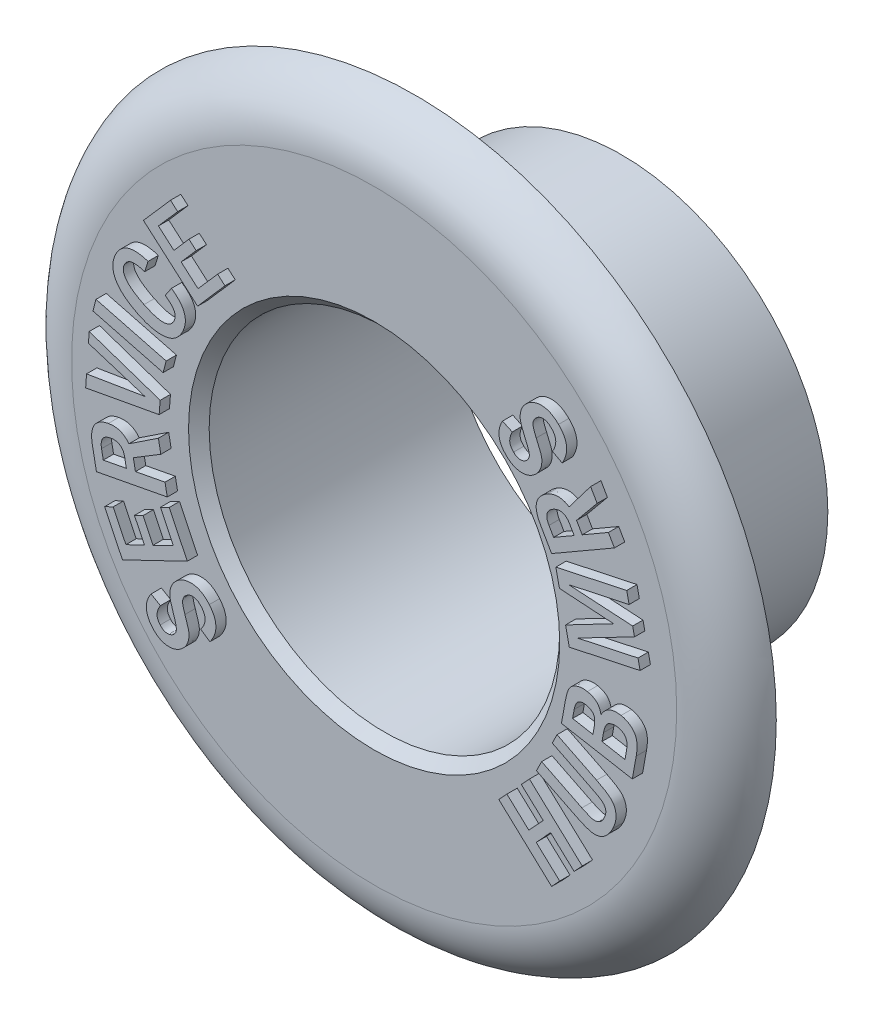
from build123d import *

# Parameters (mm, degrees)
ESQUISSE1_R        = 10
ESQUISSE1_R_2      = 8.5
BOSS_EXTRU_1_DEPTH = 10
ESQUISSE2_R        = 17.5
ESQUISSE2_R_2      = 8.5
BOSS_EXTRU_2_DEPTH = 2
CONG_1_R           = 3
CHANFREIN1_SIZE    = 0.5
BOSS_EXTRU_3_DEPTH = 0.5


with BuildPart() as part:
    # Esquisse1 → Boss.-Extru.1 (new body)
    with BuildSketch(Plane.XY):
        Circle(ESQUISSE1_R)
        Circle(ESQUISSE1_R_2, mode=Mode.SUBTRACT)
    extrude(amount=BOSS_EXTRU_1_DEPTH)

    # Esquisse2 → Boss.-Extru.2 (add)
    with BuildSketch(Plane.XY.offset(10)):
        Circle(ESQUISSE2_R)
        Circle(ESQUISSE2_R_2, mode=Mode.SUBTRACT)
    extrude(amount=BOSS_EXTRU_2_DEPTH)

    # Congé1
    # the kernel refuses this fillet: 3 mm, written as the material it takes off along each edge
    with BuildSketch(Plane(origin=(0, 0, 12), x_dir=(1, 0, 0), z_dir=(0, -1, 0))) as cong_1_piece_1:
        with BuildLine():
            CenterArc((14.671572875, -3), CONG_1_R, 19.471220634, 70.528779366)
            Line((14.671572875, 0), (14.671572875, 0.06))
            Line((14.671572875, 0.06), (17.5, 0.06))
            Line((17.5, 0.06), (17.56, 0))
            ThreePointArc((17.56, 0), (17.56, -1), (17.556568542, -1.98))
            Line((17.556568542, -1.98), (17.5, -2))
        make_face()
    revolve(axis=Axis((0, 0, 12), (0, 0, 1)), mode=Mode.SUBTRACT)

    # Chanfrein1
    chanfrein1_edges = [part.edges().sort_by_distance(p)[0] for p in [
        (-8.5, 0, 12),
    ]]
    chamfer(chanfrein1_edges, length=CHANFREIN1_SIZE)

    # Esquisse3 → Boss.-Extru.3 (add)
    # profile 1 of 13: a face of its own
    with BuildSketch(Plane.XY.offset(12)):
        Polygon((-10.68446492, 8.147242191), (-9.374243566, 9.650388892), (-9.026370302, 9.347328996), (-9.958336448, 8.278644101), (-9.208661969, 7.624672746), (-8.477976205, 8.462454864), (-8.127824295, 8.157116323), (-8.858510059, 7.319334205), (-8.037438011, 6.603079864), (-7.089521344, 7.689234378), (-6.734052594, 7.379338545), (-8.060224469, 5.858722226), align=None)
    # profile 2 of 13: a face of its own
    with BuildSketch(Plane.XY.offset(12)):
        with BuildLine():
            Line((-9.629167081, 5.527917033), (-9.327626283, 5.973772068))
            add(Edge.make_bspline(
                [(-9.327626283, 5.973772068), (-9.288523151, 5.946412466), (-9.212247057, 5.89304376), (-9.107112651, 5.807054021), (-9.011973374, 5.720329142), (-8.928285511, 5.631574205), (-8.855470707, 5.540730464), (-8.793890013, 5.44824142), (-8.742978381, 5.353996308), (-8.703537218, 5.257978965), (-8.673680199, 5.160228846), (-8.657805151, 5.060066664), (-8.65033756, 4.958597019), (-8.655158448, 4.855396274), (-8.671523419, 4.75090668), (-8.698381765, 4.644612685), (-8.736398456, 4.536602557), (-8.769261427, 4.465812838), (-8.786068123, 4.429609741)],
                knots=[0, 0, 0, 0, 1.25831485, 2.45451805, 3.579291553, 4.651643519, 5.668437617, 6.646312129, 7.578428866, 8.488641703, 9.380244482, 10.267259418, 11.157410686, 12.059775972, 12.985291658, 13.942449899, 14.947733, 16, 16, 16, 16], degree=3))
            add(Edge.make_bspline(
                [(-8.786068123, 4.429609741), (-8.81018458, 4.383990006), (-8.857164132, 4.295121447), (-8.941744596, 4.17424993), (-9.036572059, 4.070271564), (-9.140141608, 3.981492211), (-9.253338153, 3.90889875), (-9.375881609, 3.851979466), (-9.508024686, 3.81283806), (-9.647996102, 3.788642515), (-9.794917323, 3.780390366), (-9.9472984, 3.7844226), (-10.104714086, 3.80072544), (-10.266500887, 3.833417166), (-10.433894746, 3.875891862), (-10.605605251, 3.934902249), (-10.782820552, 4.005059515), (-10.900444854, 4.060799242), (-10.960655796, 4.089331964)],
                knots=[0, 0, 0, 0, 0.995387172, 1.939042868, 2.838471923, 3.705148016, 4.564615462, 5.426122934, 6.304269616, 7.216983654, 8.162005062, 9.139719801, 10.157035791, 11.212287137, 12.322937725, 13.488188407, 14.714223669, 16, 16, 16, 16], degree=3))
            add(Edge.make_bspline(
                [(-10.960655796, 4.089331964), (-11.024625405, 4.121729481), (-11.148771362, 4.184603414), (-11.322823813, 4.288936283), (-11.482513303, 4.394292836), (-11.624351326, 4.505474254), (-11.7511753, 4.619037692), (-11.861491547, 4.736510345), (-11.955839706, 4.857932349), (-12.033877365, 4.982722027), (-12.094992332, 5.110343035), (-12.138855826, 5.240145813), (-12.166254265, 5.371734131), (-12.174081114, 5.505409196), (-12.165597993, 5.64032507), (-12.140213385, 5.776841018), (-12.096589977, 5.914884746), (-12.055637119, 6.004551454), (-12.034657533, 6.050486477)],
                knots=[0, 0, 0, 0, 1.36088723, 2.641076774, 3.850211054, 4.990550643, 6.0591517, 7.079351571, 8.04558552, 8.973893925, 9.868283002, 10.725557099, 11.569234989, 12.412049838, 13.259661871, 14.12981556, 15.041930203, 16, 16, 16, 16], degree=3))
            add(Edge.make_bspline(
                [(-12.034657533, 6.050486477), (-12.01652265, 6.085263021), (-11.981137638, 6.153119455), (-11.918996908, 6.247158573), (-11.85151828, 6.331725909), (-11.778308094, 6.406645257), (-11.699608943, 6.471925409), (-11.614881406, 6.526813123), (-11.524337953, 6.571833383), (-11.428542262, 6.607954947), (-11.326671475, 6.632474705), (-11.219692835, 6.64879245), (-11.107049122, 6.654182251), (-10.988647643, 6.651516802), (-10.864875715, 6.636983963), (-10.735461796, 6.614242785), (-10.600506815, 6.581420565), (-10.509833527, 6.552834093), (-10.463151456, 6.538116686)],
                knots=[0, 0, 0, 0, 1.02887218, 2.007548468, 2.952992882, 3.864623913, 4.752053024, 5.631258426, 6.507948933, 7.401601169, 8.312214402, 9.252953045, 10.237881195, 11.268233043, 12.357988157, 13.505130795, 14.715546058, 16, 16, 16, 16], degree=3))
            Line((-10.463151456, 6.538116686), (-10.628733053, 6.020104533))
            add(Edge.make_bspline(
                [(-10.628733053, 6.020104533), (-10.659284304, 6.03073682), (-10.718742162, 6.051429033), (-10.806615965, 6.077366329), (-10.89059078, 6.097112446), (-10.97037151, 6.112045558), (-11.046299705, 6.12017085), (-11.117876374, 6.123762672), (-11.185223932, 6.120599536), (-11.248527079, 6.112348989), (-11.307993987, 6.098984017), (-11.363248167, 6.079315092), (-11.413439469, 6.05283468), (-11.460879665, 6.022610163), (-11.502895401, 5.985089734), (-11.541526442, 5.94273923), (-11.576123915, 5.894759269), (-11.594564513, 5.859089535), (-11.60399347, 5.840851061)],
                knots=[0, 0, 0, 0, 1.413799054, 2.751490137, 4.002320606, 5.183148462, 6.296449753, 7.337619889, 8.312456566, 9.238987682, 10.124841889, 10.971971393, 11.793562264, 12.600792888, 13.424244837, 14.246803994, 15.103564363, 16, 16, 16, 16], degree=3))
            add(Edge.make_bspline(
                [(-11.60399347, 5.840851061), (-11.615174608, 5.816079379), (-11.637111522, 5.767478402), (-11.655803847, 5.690905822), (-11.663107717, 5.614325479), (-11.657428003, 5.537974141), (-11.64041178, 5.461436327), (-11.611004664, 5.385097142), (-11.56960988, 5.308814069), (-11.515353809, 5.233214837), (-11.449787203, 5.157470957), (-11.372597091, 5.081285228), (-11.283002271, 5.005218028), (-11.181591009, 4.929215913), (-11.068422054, 4.852676526), (-10.942679842, 4.77732874), (-10.805745366, 4.700369443), (-10.708955482, 4.651999665), (-10.659114998, 4.62709238)],
                knots=[0, 0, 0, 0, 0.762739505, 1.496462176, 2.204065549, 2.917622913, 3.639510571, 4.400986876, 5.209955146, 6.073014985, 7.011856248, 8.023561265, 9.119133035, 10.313562916, 11.58498584, 12.958347195, 14.433746976, 16, 16, 16, 16], degree=3))
            add(Edge.make_bspline(
                [(-10.659114998, 4.62709238), (-10.612152376, 4.604789843), (-10.52113503, 4.561565728), (-10.386967021, 4.503360182), (-10.258935918, 4.455786848), (-10.138201985, 4.415335725), (-10.023635328, 4.385934168), (-9.915894253, 4.364839714), (-9.814793259, 4.353085173), (-9.720250628, 4.35084177), (-9.632254647, 4.356029984), (-9.550911717, 4.372301282), (-9.476025688, 4.396912023), (-9.40814468, 4.431844591), (-9.346433462, 4.475279497), (-9.29263992, 4.529257152), (-9.244493259, 4.59125456), (-9.219603038, 4.6380633), (-9.206858053, 4.662031616)],
                knots=[0, 0, 0, 0, 1.53911643, 2.98293173, 4.32778885, 5.58167492, 6.750622574, 7.826677445, 8.829887108, 9.75958998, 10.623645347, 11.433600667, 12.208678301, 12.949511569, 13.685780671, 14.433107302, 15.197675913, 16, 16, 16, 16], degree=3))
            add(Edge.make_bspline(
                [(-9.206858053, 4.662031616), (-9.197875835, 4.681879427), (-9.180438706, 4.720409868), (-9.16110149, 4.779360296), (-9.149506607, 4.837497929), (-9.145528884, 4.894712099), (-9.149521356, 4.950607241), (-9.160150064, 5.005307331), (-9.17846353, 5.058776824), (-9.214886129, 5.129861082), (-9.276884659, 5.218549592), (-9.372458475, 5.322651747), (-9.491234603, 5.427701806), (-9.581463575, 5.493257917), (-9.629167081, 5.527917033)],
                knots=[0, 0, 0, 0, 0.734552614, 1.425982771, 2.087600162, 2.729576946, 3.354511132, 3.972579313, 4.604593488, 5.253913844, 6.661062636, 8.239250348, 10.011714634, 12, 12, 12, 12], degree=3))
        make_face()
    # profile 3 of 13: a face of its own
    with BuildSketch(Plane.XY.offset(12)):
        Polygon((-13.133591563, 3.119179753), (-12.986998681, 3.682005274), (-9.584980452, 2.795612045), (-9.731573334, 2.232786524), align=None)
    # profile 4 of 13: a face of its own
    with BuildSketch(Plane.XY.offset(12)):
        Polygon((-13.487774917, -0.285368175), (-13.445240195, 0.32454936), (-10.607566584, 0.793190853), (-13.351815715, 1.655278526), (-13.316116931, 2.167973839), (-9.873842625, 0.999788075), (-9.925491931, 0.372400922), align=None)
    # profile 5 of 13: a face of its own
    with BuildSketch(Plane.XY.offset(12)):
        with BuildLine():
            Line((-12.965405852, -3.544240459), (-13.162128942, -2.5104948))
            add(Edge.make_bspline(
                [(-13.162128942, -2.5104948), (-13.17008957, -2.465013184), (-13.185462186, -2.377184512), (-13.197760614, -2.247949754), (-13.200024323, -2.12660272), (-13.194061619, -2.012602975), (-13.17631, -1.906555741), (-13.149844896, -1.807998756), (-13.114405164, -1.716492165), (-13.067588988, -1.633276534), (-13.011540857, -1.557876991), (-12.948086226, -1.488619313), (-12.875503261, -1.426717498), (-12.793638717, -1.373147109), (-12.704194849, -1.325678323), (-12.606213687, -1.285525798), (-12.499834641, -1.251767873), (-12.425028715, -1.236310979), (-12.38662981, -1.228376744)],
                knots=[0, 0, 0, 0, 1.290793418, 2.49262631, 3.625590054, 4.682399745, 5.679870009, 6.626179873, 7.532004329, 8.416325126, 9.287166724, 10.153941036, 11.037808278, 11.946946737, 12.8843961, 13.865220213, 14.904188337, 16, 16, 16, 16], degree=3))
            add(Edge.make_bspline(
                [(-12.38662981, -1.228376744), (-12.335364083, -1.22026901), (-12.236027982, -1.204558892), (-12.088933948, -1.202537929), (-11.950051897, -1.217857883), (-11.819456852, -1.252807835), (-11.697879044, -1.307937076), (-11.58437868, -1.380582285), (-11.479849702, -1.47305104), (-11.419542924, -1.545759331), (-11.388582935, -1.583085945)],
                knots=[0, 0, 0, 0, 1.10925397, 2.149368998, 3.136351053, 4.090288788, 5.028550404, 5.981149299, 6.963572659, 8, 8, 8, 8], degree=3))
            Line((-11.388582935, -1.583085945), (-9.960631547, -0.635169279))
            Line((-9.960631547, -0.635169279), (-9.842901512, -1.251922751))
            Line((-9.842901512, -1.251922751), (-11.174390227, -2.060842022))
            Line((-11.174390227, -2.060842022), (-11.073370262, -2.594045147))
            Line((-11.073370262, -2.594045147), (-9.639342484, -2.320607647))
            Line((-9.639342484, -2.320607647), (-9.530727033, -2.889509557))
            Line((-9.530727033, -2.889509557), (-12.965405852, -3.544240459))
        make_face()
        with BuildLine():
            Line((-12.633483109, -2.891028654), (-11.513908456, -2.677595494))
            Line((-11.513908456, -2.677595494), (-11.596699255, -2.24237414))
            add(Edge.make_bspline(
                [(-11.596699255, -2.24237414), (-11.60168705, -2.219003108), (-11.611373057, -2.173617924), (-11.630882925, -2.108868857), (-11.655294572, -2.050216025), (-11.683432073, -1.997047911), (-11.716129362, -1.949943556), (-11.752724351, -1.90818378), (-11.794288414, -1.873190408), (-11.854086854, -1.833608608), (-11.937611993, -1.797561564), (-12.046234501, -1.77311482), (-12.164176856, -1.768518469), (-12.243955168, -1.780926114), (-12.285609845, -1.787404522)],
                knots=[0, 0, 0, 0, 0.914520806, 1.775946179, 2.584041781, 3.342806041, 4.074024624, 4.774208137, 5.461667363, 6.147074263, 7.513839802, 8.915044919, 10.389251365, 12, 12, 12, 12], degree=3))
            add(Edge.make_bspline(
                [(-12.285609845, -1.787404522), (-12.30720935, -1.791885773), (-12.349284331, -1.800615074), (-12.409298565, -1.818800401), (-12.464099077, -1.840876791), (-12.514077707, -1.866013391), (-12.559154408, -1.894722795), (-12.598946, -1.927856423), (-12.634135785, -1.963922386), (-12.663088889, -2.004581586), (-12.68882559, -2.047515902), (-12.707199177, -2.095255634), (-12.722152535, -2.14570938), (-12.73078397, -2.200070364), (-12.735515075, -2.257975203), (-12.734525427, -2.319487234), (-12.728254543, -2.384434041), (-12.720853602, -2.428502949), (-12.717033456, -2.451250008)],
                knots=[0, 0, 0, 0, 1.165356172, 2.270067758, 3.308625834, 4.283981557, 5.222959475, 6.125779299, 7.015315027, 7.877045866, 8.758291616, 9.652744439, 10.571680299, 11.535124667, 12.555159645, 13.639012621, 14.78132856, 16, 16, 16, 16], degree=3))
            Line((-12.717033456, -2.451250008), (-12.633483109, -2.891028654))
        make_face(mode=Mode.SUBTRACT)
    # profile 6 of 13: a face of its own
    with BuildSketch(Plane.XY.offset(12)):
        Polygon((-11.702584446, -6.614832221), (-12.569229411, -4.813942464), (-12.152237224, -4.613421631), (-11.5362433, -5.894020589), (-10.638456842, -5.46183743), (-11.121529758, -4.457714166), (-10.702258925, -4.255674235), (-10.219186008, -5.259797499), (-9.236330106, -4.786598714), (-9.862198161, -3.485491943), (-9.43609139, -3.280413818), (-8.559572293, -5.101811388), align=None)
    # profile 7 of 13: a face of its own
    with BuildSketch(Plane.XY.offset(12)):
        with BuildLine():
            Line((-10.314825514, -7.352409652), (-9.864413188, -7.618251666))
            add(Edge.make_bspline(
                [(-9.864413188, -7.618251666), (-9.887816073, -7.657535695), (-9.932180437, -7.732005612), (-9.98211838, -7.845457071), (-10.015106839, -7.952158308), (-10.030326203, -8.054042303), (-10.024278486, -8.153295863), (-9.995873138, -8.250434551), (-9.945800643, -8.346320416), (-9.899882194, -8.404842111), (-9.875806417, -8.435525972)],
                knots=[0, 0, 0, 0, 1.232774222, 2.336944519, 3.335370675, 4.238619663, 5.101039672, 5.996167596, 6.949358623, 8, 8, 8, 8], degree=3))
            add(Edge.make_bspline(
                [(-9.875806417, -8.435525972), (-9.851422806, -8.461870093), (-9.804848098, -8.512189534), (-9.722775909, -8.568669112), (-9.636474502, -8.60539575), (-9.546890271, -8.61921404), (-9.458986529, -8.615303045), (-9.375733095, -8.59597163), (-9.297762077, -8.562869341), (-9.253354714, -8.528713599), (-9.230949646, -8.511480833)],
                knots=[0, 0, 0, 0, 1.183094996, 2.259808946, 3.264987231, 4.256601532, 5.227929008, 6.15532004, 7.069294426, 8, 8, 8, 8], degree=3))
            add(Edge.make_bspline(
                [(-9.230949646, -8.511480833), (-9.20857995, -8.490658342), (-9.165242752, -8.450318572), (-9.119788487, -8.375284532), (-9.092645751, -8.293731407), (-9.088068083, -8.220297168), (-9.092349629, -8.156334771), (-9.10023612, -8.100042488), (-9.112597308, -8.036215466), (-9.129334223, -7.965019173), (-9.151010506, -7.886354094), (-9.176646486, -7.800190078), (-9.207228603, -7.706549085), (-9.229814254, -7.642008665), (-9.241583327, -7.608377534)],
                knots=[0, 0, 0, 0, 1.132970691, 2.194923599, 3.226112079, 4.303839073, 4.908178949, 5.611925179, 6.417809656, 7.327644688, 8.333588555, 9.454738265, 10.673698924, 12, 12, 12, 12], degree=3))
            add(Edge.make_bspline(
                [(-9.241583327, -7.608377534), (-9.261397566, -7.551594778), (-9.298849392, -7.444267017), (-9.34324679, -7.289326809), (-9.378372114, -7.151839301), (-9.40114553, -7.027840982), (-9.410306258, -6.911728672), (-9.40493781, -6.798444242), (-9.385372944, -6.685337001), (-9.353087411, -6.573087079), (-9.305663894, -6.463352024), (-9.240275023, -6.360207354), (-9.161496475, -6.261650147), (-9.097892162, -6.204389552), (-9.065368049, -6.175109305)],
                knots=[0, 0, 0, 0, 1.388615614, 2.624687759, 3.720901215, 4.664891461, 5.532645414, 6.404820446, 7.276681831, 8.177833469, 9.096866396, 10.026551273, 10.990875536, 12, 12, 12, 12], degree=3))
            add(Edge.make_bspline(
                [(-9.065368049, -6.175109305), (-9.037451177, -6.152479592), (-8.982283285, -6.107759914), (-8.892800977, -6.051894722), (-8.800797359, -6.004836639), (-8.704984363, -5.96942045), (-8.606784256, -5.942266848), (-8.505113887, -5.926274739), (-8.400290044, -5.921626442), (-8.293181811, -5.924768171), (-8.185128749, -5.939996362), (-8.078574494, -5.967323269), (-7.974470134, -6.007321049), (-7.873022908, -6.059453709), (-7.773628273, -6.123626201), (-7.677548901, -6.20106965), (-7.582577405, -6.28922844), (-7.523952875, -6.355358605), (-7.493861973, -6.389302013)],
                knots=[0, 0, 0, 0, 0.967342925, 1.911613474, 2.835890215, 3.746781221, 4.658489078, 5.576908237, 6.512591293, 7.48176012, 8.459888433, 9.445880936, 10.439019768, 11.457895025, 12.513616084, 13.620411782, 14.778600733, 16, 16, 16, 16], degree=3))
            add(Edge.make_bspline(
                [(-7.493861973, -6.389302013), (-7.468810606, -6.41955996), (-7.419832022, -6.478718065), (-7.356135225, -6.572042635), (-7.300920305, -6.665377035), (-7.255968039, -6.75970882), (-7.220802787, -6.854566372), (-7.194527787, -6.949787607), (-7.178685325, -7.046042068), (-7.17190711, -7.142651825), (-7.173711159, -7.239917915), (-7.187311547, -7.337494605), (-7.209466277, -7.435795423), (-7.24051891, -7.534819655), (-7.282218044, -7.633810995), (-7.332501799, -7.733661739), (-7.392599081, -7.834249752), (-7.438960544, -7.899344284), (-7.46272048, -7.932704791)],
                knots=[0, 0, 0, 0, 1.113883725, 2.177783286, 3.201475387, 4.187797156, 5.137750011, 6.068196147, 6.985688545, 7.900167732, 8.812613736, 9.740060933, 10.68974221, 11.668819236, 12.679910399, 13.73350413, 14.838436184, 16, 16, 16, 16], degree=3))
            Line((-7.46272048, -7.932704791), (-7.907815966, -7.633442638))
            add(Edge.make_bspline(
                [(-7.907815966, -7.633442638), (-7.891933411, -7.612060279), (-7.860893692, -7.570272136), (-7.818507055, -7.506699105), (-7.784252759, -7.442575495), (-7.753509855, -7.380326575), (-7.731254702, -7.317644948), (-7.713269182, -7.256129529), (-7.701925325, -7.1950793), (-7.696131896, -7.134780537), (-7.698188473, -7.075241589), (-7.704689122, -7.016423017), (-7.717920992, -6.958182594), (-7.73693856, -6.900438015), (-7.761962677, -6.84336387), (-7.793809143, -6.78753377), (-7.830777343, -6.731895365), (-7.859646956, -6.69668054), (-7.874395827, -6.678690034)],
                knots=[0, 0, 0, 0, 1.216945066, 2.378309676, 3.486077645, 4.53637461, 5.546344029, 6.520301286, 7.461778301, 8.379143167, 9.281657489, 10.178371626, 11.079179519, 12.004603382, 12.952383183, 13.92083003, 14.937796249, 16, 16, 16, 16], degree=3))
            add(Edge.make_bspline(
                [(-7.874395827, -6.678690034), (-7.889289547, -6.66169564), (-7.918123569, -6.628794742), (-7.965141132, -6.585390035), (-8.011971784, -6.547430596), (-8.059216929, -6.514707159), (-8.108162517, -6.489644892), (-8.157706903, -6.4708751), (-8.207595189, -6.456291881), (-8.274404362, -6.448096872), (-8.356910399, -6.449274215), (-8.452994548, -6.468515254), (-8.543176157, -6.510240632), (-8.596144827, -6.550292707), (-8.623310757, -6.570834131)],
                knots=[0, 0, 0, 0, 0.953603482, 1.846162269, 2.697696338, 3.498312667, 4.268142649, 5.012688264, 5.733759895, 6.456493986, 7.846495211, 9.201013947, 10.564489874, 12, 12, 12, 12], degree=3))
            add(Edge.make_bspline(
                [(-8.623310757, -6.570834131), (-8.642227093, -6.588436584), (-8.679802587, -6.623402176), (-8.723956808, -6.686967659), (-8.757656982, -6.757512736), (-8.778223687, -6.82212742), (-8.78634872, -6.880770979), (-8.786495183, -6.932725147), (-8.781966911, -6.991951931), (-8.770576624, -7.058542415), (-8.754680173, -7.132550253), (-8.733388858, -7.213980756), (-8.705489198, -7.302409415), (-8.684469845, -7.363598133), (-8.673440966, -7.395703923)],
                knots=[0, 0, 0, 0, 1.045037225, 2.07586664, 3.11326597, 4.207396121, 4.808299537, 5.506274967, 6.309172229, 7.213560656, 8.242190775, 9.377334243, 10.623884286, 12, 12, 12, 12], degree=3))
            add(Edge.make_bspline(
                [(-8.673440966, -7.395703923), (-8.661511182, -7.429873016), (-8.638470506, -7.495865751), (-8.605651771, -7.591434738), (-8.576623504, -7.680516528), (-8.551554449, -7.763074097), (-8.530314796, -7.839374959), (-8.511900359, -7.908904337), (-8.497376291, -7.971970267), (-8.482881135, -8.047365792), (-8.472271981, -8.139275482), (-8.477108476, -8.251092331), (-8.494627979, -8.366100545), (-8.526946847, -8.482596142), (-8.574644494, -8.597165987), (-8.637806024, -8.706390496), (-8.719536018, -8.806588717), (-8.783576229, -8.865677655), (-8.816236105, -8.89581243)],
                knots=[0, 0, 0, 0, 1.065855494, 2.058548027, 2.975790485, 3.824954578, 4.599258703, 5.308192774, 5.943071298, 6.504622996, 7.569304222, 8.658557854, 9.790069877, 10.989440537, 12.209401177, 13.435793292, 14.6922799, 16, 16, 16, 16], degree=3))
            add(Edge.make_bspline(
                [(-8.816236105, -8.89581243), (-8.842658339, -8.917382506), (-8.894669673, -8.959842519), (-8.978842374, -9.013153342), (-9.06562799, -9.056220358), (-9.154562823, -9.091423771), (-9.246725144, -9.115218043), (-9.34153454, -9.130836935), (-9.439061314, -9.135949598), (-9.538250482, -9.131263323), (-9.637414363, -9.117319079), (-9.734501814, -9.091685536), (-9.828814124, -9.056950524), (-9.920100645, -9.011450221), (-10.008531444, -8.955892231), (-10.093490084, -8.888934168), (-10.177039283, -8.813416376), (-10.227525394, -8.75583328), (-10.253302077, -8.72643309)],
                knots=[0, 0, 0, 0, 1.008097408, 1.984407887, 2.938792323, 3.87046422, 4.807656473, 5.748163271, 6.708054267, 7.690005311, 8.681191697, 9.663742108, 10.654079609, 11.64865429, 12.67494191, 13.736886648, 14.844522675, 16, 16, 16, 16], degree=3))
            add(Edge.make_bspline(
                [(-10.253302077, -8.72643309), (-10.275196967, -8.699628308), (-10.318159163, -8.647031911), (-10.374887171, -8.564964266), (-10.424363983, -8.482581764), (-10.464212475, -8.398876261), (-10.497519743, -8.315096117), (-10.521889503, -8.230388693), (-10.538052644, -8.14494252), (-10.545376201, -8.05895276), (-10.545653505, -7.972509035), (-10.537047938, -7.885287073), (-10.520283223, -7.797657561), (-10.495628623, -7.709254028), (-10.462817289, -7.620380642), (-10.421722535, -7.530737948), (-10.372046349, -7.440872429), (-10.334171653, -7.382318567), (-10.314825514, -7.352409652)],
                knots=[0, 0, 0, 0, 1.108987317, 2.176057143, 3.194850275, 4.185755594, 5.144227614, 6.081718795, 7.006478461, 7.927098242, 8.844134159, 9.773582296, 10.73174506, 11.70046914, 12.712061313, 13.765183945, 14.858471117, 16, 16, 16, 16], degree=3))
        make_face()
    # profile 8 of 13: a face of its own
    with BuildSketch(Plane.XY.offset(12)):
        with BuildLine():
            Line((9.582545549, -2.839003623), (9.769394508, -1.799941123))
            add(Edge.make_bspline(
                [(9.769394508, -1.799941123), (9.775322491, -1.768263173), (9.786822545, -1.7068092), (9.805977434, -1.617960404), (9.825132764, -1.535166469), (9.847021061, -1.459234437), (9.86767234, -1.388965964), (9.89065745, -1.32523928), (9.913940323, -1.267584739), (9.946034212, -1.199073395), (9.996408205, -1.121895143), (10.075083374, -1.041669705), (10.171265762, -0.973042896), (10.283817588, -0.917454787), (10.409218354, -0.876222448), (10.545323788, -0.855446415), (10.689896362, -0.853642395), (10.787562866, -0.868095046), (10.838079403, -0.875570464)],
                knots=[0, 0, 0, 0, 0.945251826, 1.833751188, 2.665935571, 3.437134741, 4.151302968, 4.813708576, 5.423259351, 5.974664238, 7.031324814, 8.107943656, 9.251821701, 10.480656032, 11.777020425, 13.107833483, 14.504070144, 16, 16, 16, 16], degree=3))
            add(Edge.make_bspline(
                [(10.838079403, -0.875570464), (10.883496131, -0.88520571), (10.970918446, -0.903752524), (11.092335884, -0.950934778), (11.199387301, -1.010563778), (11.290564628, -1.08574418), (11.367258956, -1.174252446), (11.427117628, -1.277548221), (11.473139661, -1.394023378), (11.489597496, -1.477778676), (11.498127146, -1.521186783)],
                knots=[0, 0, 0, 0, 1.119188445, 2.154317361, 3.131474543, 4.065056187, 4.992475773, 5.943185146, 6.934008464, 8, 8, 8, 8], degree=3))
            add(Edge.make_bspline(
                [(11.498127146, -1.521186783), (11.510941804, -1.497683313), (11.536099445, -1.451541474), (11.579085468, -1.38723196), (11.623446525, -1.327217173), (11.672520224, -1.274287468), (11.723437494, -1.226213617), (11.776921842, -1.182969659), (11.833970188, -1.146156756), (11.893346147, -1.11367092), (11.956145054, -1.08798178), (12.02147132, -1.067500411), (12.089796898, -1.05218722), (12.160915917, -1.042276323), (12.234858518, -1.038759657), (12.311477787, -1.040417832), (12.390926358, -1.047074462), (12.444571593, -1.055734299), (12.471868466, -1.060140776)],
                knots=[0, 0, 0, 0, 1.100362842, 2.160224182, 3.178559253, 4.166140734, 5.12373614, 6.05713696, 6.989956837, 7.912374713, 8.836671243, 9.775226613, 10.725034944, 11.713110312, 12.724447902, 13.765889823, 14.863194041, 16, 16, 16, 16], degree=3))
            add(Edge.make_bspline(
                [(12.471868466, -1.060140776), (12.502909626, -1.066374546), (12.564435238, -1.078730287), (12.653043203, -1.107590754), (12.738064308, -1.141356641), (12.818247341, -1.18336679), (12.893248298, -1.233150561), (12.964799784, -1.28858409), (13.03052824, -1.352496546), (13.094025396, -1.42165727), (13.148704759, -1.502464623), (13.192336132, -1.595336454), (13.222659489, -1.700783245), (13.24345871, -1.81786036), (13.250534107, -1.947202756), (13.248394795, -2.088634703), (13.233273622, -2.242104764), (13.216070495, -2.34791783), (13.207111521, -2.40302272)],
                knots=[0, 0, 0, 0, 0.867820331, 1.720076762, 2.551940233, 3.375177085, 4.197710515, 5.018835295, 5.853939655, 6.709867066, 7.590186971, 8.519135842, 9.512328034, 10.591367383, 11.774525608, 13.059562109, 14.468690939, 16, 16, 16, 16], degree=3))
            Line((13.207111521, -2.40302272), (13.017224369, -3.457276193))
            Line((13.017224369, -3.457276193), (9.582545549, -2.839003623))
        make_face()
        with BuildLine():
            Line((11.106959612, -2.53974147), (11.171521244, -2.179715429))
            add(Edge.make_bspline(
                [(11.171521244, -2.179715429), (11.176697742, -2.14938715), (11.186626754, -2.091214657), (11.195069359, -2.006969664), (11.197414839, -1.930068494), (11.194853403, -1.860418137), (11.186130244, -1.797895885), (11.170938348, -1.742801329), (11.150667143, -1.694499267), (11.114503047, -1.640902636), (11.058411516, -1.584693695), (10.978546234, -1.53045792), (10.885229854, -1.490787337), (10.817631815, -1.475785638), (10.782632355, -1.46801838)],
                knots=[0, 0, 0, 0, 1.180910116, 2.265096755, 3.247233192, 4.132592379, 4.938108239, 5.66443435, 6.321728177, 6.939071705, 8.135046123, 9.34550726, 10.625613766, 12, 12, 12, 12], degree=3))
            add(Edge.make_bspline(
                [(10.782632355, -1.46801838), (10.761662767, -1.46463843), (10.721399103, -1.458148595), (10.662158392, -1.454209702), (10.606773949, -1.455857649), (10.554984904, -1.461398014), (10.507088145, -1.47309429), (10.46288898, -1.489381414), (10.422981016, -1.512169991), (10.385987598, -1.53859023), (10.352881861, -1.571450478), (10.322791608, -1.609321539), (10.295284182, -1.652448642), (10.270115375, -1.700716914), (10.247450766, -1.754546233), (10.227947273, -1.813785685), (10.211109748, -1.878256362), (10.202338169, -1.923185895), (10.197779924, -1.946534005)],
                knots=[0, 0, 0, 0, 1.167609834, 2.241925356, 3.258673122, 4.21195478, 5.100074023, 5.963738321, 6.792702101, 7.619793042, 8.456669626, 9.348165554, 10.275053664, 11.265239815, 12.338381862, 13.483105849, 14.692069123, 16, 16, 16, 16], degree=3))
            Line((10.197779924, -1.946534005), (10.12334416, -2.362007095))
            Line((10.12334416, -2.362007095), (11.106959612, -2.53974147))
        make_face(mode=Mode.SUBTRACT)
        with BuildLine():
            Line((12.661755619, -2.819255359), (12.743786869, -2.361247547))
            add(Edge.make_bspline(
                [(12.743786869, -2.361247547), (12.747955559, -2.335721565), (12.756016482, -2.286362423), (12.761694445, -2.21375567), (12.764042887, -2.145209787), (12.759035434, -2.080714161), (12.750413989, -2.020355014), (12.735854888, -1.964321585), (12.716058028, -1.912321935), (12.691088245, -1.864195958), (12.66024077, -1.820443814), (12.62426561, -1.780671764), (12.583185968, -1.745017489), (12.53714992, -1.713497238), (12.485512958, -1.686805087), (12.428624909, -1.664496463), (12.366819374, -1.644970845), (12.323355572, -1.636462835), (12.300970028, -1.63208088)],
                knots=[0, 0, 0, 0, 1.269316076, 2.454454208, 3.573532925, 4.632808939, 5.62613395, 6.563840724, 7.468841299, 8.352939145, 9.218578538, 10.089911819, 10.979845933, 11.88322288, 12.822905162, 13.82706114, 14.88085224, 16, 16, 16, 16], degree=3))
            add(Edge.make_bspline(
                [(12.300970028, -1.63208088), (12.265343935, -1.627303483), (12.195197549, -1.617896975), (12.089089146, -1.62526848), (11.986342372, -1.651066708), (11.90350243, -1.685905167), (11.840220109, -1.725098681), (11.797758024, -1.766933058), (11.757647325, -1.816395766), (11.723152808, -1.876860907), (11.691380445, -1.945968491), (11.663195045, -2.024685785), (11.640095815, -2.113293399), (11.627674032, -2.175846032), (11.621174021, -2.208578276)],
                knots=[0, 0, 0, 0, 1.264406386, 2.489566779, 3.721047904, 4.984162584, 5.642572449, 6.330611678, 7.073412802, 7.881473896, 8.775833638, 9.752462209, 10.823919145, 12, 12, 12, 12], degree=3))
            Line((11.621174021, -2.208578276), (11.547497806, -2.618734526))
            Line((11.547497806, -2.618734526), (12.661755619, -2.819255359))
        make_face(mode=Mode.SUBTRACT)
    # profile 9 of 13: a face of its own
    with BuildSketch(Plane.XY.offset(12)):
        with BuildLine():
            Line((8.369226136, -5.433141747), (8.622155824, -4.924244178))
            Line((8.622155824, -4.924244178), (10.572676657, -5.892668657))
            add(Edge.make_bspline(
                [(10.572676657, -5.892668657), (10.598962699, -5.905673514), (10.64981626, -5.930833), (10.724259041, -5.96579501), (10.793950941, -5.996821037), (10.858691258, -6.024375007), (10.918654938, -6.04812686), (10.974095834, -6.067465982), (11.024132406, -6.084895573), (11.084147816, -6.100760517), (11.155169869, -6.113303661), (11.238829601, -6.111529016), (11.319991174, -6.095489079), (11.39836571, -6.063758283), (11.472989139, -6.016391006), (11.540235686, -5.950422596), (11.602325934, -5.869535321), (11.635447881, -5.80690481), (11.652754782, -5.774179074)],
                knots=[0, 0, 0, 0, 1.11257379, 2.152409961, 3.119856868, 4.006494984, 4.821626478, 5.565942933, 6.234169589, 6.830613525, 7.920187297, 8.957714101, 9.986220702, 11.042124719, 12.147877941, 13.316386701, 14.597756592, 16, 16, 16, 16], degree=3))
            add(Edge.make_bspline(
                [(11.652754782, -5.774179074), (11.667530774, -5.742618798), (11.695535134, -5.682803843), (11.722404778, -5.59223278), (11.735481384, -5.508059948), (11.733690997, -5.429428825), (11.716817455, -5.356703721), (11.689520899, -5.288120123), (11.648975978, -5.224158434), (11.605138271, -5.174744304), (11.562207534, -5.134246072), (11.519344806, -5.102395233), (11.468012812, -5.067024906), (11.407287356, -5.029706455), (11.338236682, -4.988357535), (11.259494244, -4.945197381), (11.171897025, -4.899076984), (11.1099922, -4.868170839), (11.077776484, -4.85208706)],
                knots=[0, 0, 0, 0, 1.318552033, 2.499000043, 3.565089949, 4.534188072, 5.457947024, 6.378713874, 7.318073962, 8.310524937, 8.873775298, 9.550929321, 10.330384761, 11.235179121, 12.250038152, 13.379067315, 14.636047812, 16, 16, 16, 16], degree=3))
            Line((11.077776484, -4.85208706), (9.136370234, -3.888219872))
            Line((9.136370234, -3.888219872), (9.36803256, -3.421097476))
            Line((9.36803256, -3.421097476), (11.283614157, -4.372052338))
            add(Edge.make_bspline(
                [(11.283614157, -4.372052338), (11.320958095, -4.390545284), (11.393326549, -4.426382586), (11.496642288, -4.482549174), (11.593236702, -4.535668726), (11.681387009, -4.589446016), (11.762553013, -4.640525759), (11.835939529, -4.690738798), (11.901150559, -4.740135859), (11.960027012, -4.788386408), (12.012659301, -4.837918434), (12.058488981, -4.891972071), (12.09976209, -4.949320001), (12.134407577, -5.011629623), (12.16555128, -5.076958136), (12.189100812, -5.147336008), (12.209513696, -5.22119443), (12.222669582, -5.299314422), (12.230666944, -5.380538118), (12.230461582, -5.46446469), (12.222594719, -5.550809309), (12.207606076, -5.63983478), (12.183166981, -5.731119289), (12.153242721, -5.825563341), (12.114050385, -5.921889118), (12.08373016, -5.985983305), (12.068227872, -6.018753726)],
                knots=[0, 0, 0, 0, 1.408901263, 2.730296061, 3.975890233, 5.135749142, 6.221086147, 7.218414266, 8.141278657, 8.98637663, 9.791686897, 10.580956907, 11.379091248, 12.176536611, 12.988508253, 13.822388097, 14.682102276, 15.577231657, 16.49723272, 17.438924595, 18.410079569, 19.426225829, 20.487251479, 21.60265965, 22.77427493, 24, 24, 24, 24], degree=3))
            add(Edge.make_bspline(
                [(12.068227872, -6.018753726), (12.042068441, -6.068409227), (11.991511102, -6.164376525), (11.902323263, -6.295894071), (11.805429562, -6.410560461), (11.717584289, -6.493972041), (11.643047389, -6.549932909), (11.585944551, -6.587284065), (11.525527067, -6.616910241), (11.463853641, -6.643712615), (11.399211952, -6.662869907), (11.332726818, -6.677599276), (11.264114137, -6.686489506), (11.191981672, -6.690837949), (11.113798689, -6.686693764), (11.027731692, -6.67315052), (10.932264378, -6.650872338), (10.827914772, -6.618213443), (10.713559474, -6.578270439), (10.590776755, -6.527112925), (10.457526983, -6.469273124), (10.366911457, -6.424743471), (10.31974697, -6.401566226)],
                knots=[0, 0, 0, 0, 1.609503038, 3.110625363, 4.548686431, 5.910753836, 6.574748575, 7.221632877, 7.864917441, 8.503095183, 9.148836291, 9.795761383, 10.455370113, 11.131962508, 11.866595279, 12.696743679, 13.628948745, 14.676879467, 15.8326055, 17.103408164, 18.492352551, 20, 20, 20, 20], degree=3))
            Line((10.31974697, -6.401566226), (8.369226136, -5.433141747))
        make_face()
    # profile 10 of 13: a face of its own
    with BuildSketch(Plane.XY.offset(12)):
        Polygon((6.545129262, -7.554482748), (6.937815894, -7.130654623), (7.998905304, -8.113510526), (8.697690026, -7.359278755), (7.636600616, -6.376422853), (8.029287248, -5.952594728), (10.588966068, -8.323145943), (10.196279436, -8.746974068), (9.05619697, -7.691201498), (8.357412248, -8.445433269), (9.497494713, -9.501205839), (9.104808081, -9.925033964), align=None)
    # profile 11 of 13: a face of its own
    with BuildSketch(Plane.XY.offset(12)):
        Polygon((9.96276153, 0.55165299), (9.78198896, 1.394751949), (12.111524551, 2.610029726), (9.485005453, 2.780928164), (9.31182837, 3.589087886), (12.746507189, 4.32509049), (12.860439481, 3.791127817), (9.929341391, 3.162981115), (13.035135662, 2.976132157), (13.124002849, 2.563697261), (10.361524551, 1.134226775), (13.294901287, 1.763133025), (13.397440349, 1.287655594), align=None)
    # profile 12 of 13: a face of its own
    with BuildSketch(Plane.XY.offset(12)):
        with BuildLine():
            Line((9.105546407, 4.053155922), (8.576141025, 4.969931095))
            add(Edge.make_bspline(
                [(8.576141025, 4.969931095), (8.553502545, 5.010378652), (8.509661257, 5.088708692), (8.456002594, 5.207570419), (8.412824303, 5.32185343), (8.381142595, 5.432254525), (8.36176904, 5.538878527), (8.35478217, 5.641557078), (8.359085708, 5.739977848), (8.375071439, 5.834419771), (8.402717608, 5.924650515), (8.441126007, 6.010849546), (8.489376785, 6.09391834), (8.548654148, 6.172311145), (8.618123335, 6.247138677), (8.698163809, 6.317263492), (8.788066469, 6.384768208), (8.853762425, 6.424524266), (8.887555955, 6.444974498)],
                knots=[0, 0, 0, 0, 1.288006234, 2.494330636, 3.621231009, 4.681779934, 5.682712124, 6.627953108, 7.536859915, 8.415082694, 9.283378528, 10.153070956, 11.033068693, 11.948032138, 12.879335268, 13.866538856, 14.902562828, 16, 16, 16, 16], degree=3))
            add(Edge.make_bspline(
                [(8.887555955, 6.444974498), (8.933621849, 6.469602086), (9.022812099, 6.517284667), (9.161464056, 6.569105361), (9.298838842, 6.598939289), (9.434487707, 6.609818058), (9.56843308, 6.597643166), (9.700625013, 6.566298004), (9.830852721, 6.513407153), (9.912299691, 6.46411334), (9.953962205, 6.438898109)],
                knots=[0, 0, 0, 0, 1.10923941, 2.147648352, 3.133313039, 4.088188583, 5.027830365, 5.979167605, 6.966284961, 8, 8, 8, 8], degree=3))
            Line((9.953962205, 6.438898109), (10.996822448, 7.81140245))
            Line((10.996822448, 7.81140245), (11.312035122, 7.26452745))
            Line((11.312035122, 7.26452745), (10.315507344, 6.054566512))
            Line((10.315507344, 6.054566512), (10.588185295, 5.582127276))
            Line((10.588185295, 5.582127276), (11.85966967, 6.316610783))
            Line((11.85966967, 6.316610783), (12.151336337, 5.812270505))
            Line((12.151336337, 5.812270505), (9.105546407, 4.053155922))
        make_face()
        with BuildLine():
            Line((9.204287726, 4.783082137), (10.197777309, 5.356541338))
            Line((10.197777309, 5.356541338), (9.975229566, 5.742392033))
            add(Edge.make_bspline(
                [(9.975229566, 5.742392033), (9.962660795, 5.763125861), (9.938457932, 5.803051641), (9.897617271, 5.857571942), (9.855251737, 5.905399561), (9.811276129, 5.947052587), (9.764439075, 5.980877673), (9.715463434, 6.007289954), (9.665114157, 6.028697029), (9.594896998, 6.045008691), (9.503847978, 6.053147427), (9.392329801, 6.039115326), (9.278668121, 6.004437583), (9.206766832, 5.966469619), (9.16934849, 5.946710609)],
                knots=[0, 0, 0, 0, 0.921517866, 1.774506892, 2.586010878, 3.348947457, 4.073052721, 4.775324547, 5.46184597, 6.146000655, 7.508370048, 8.913903209, 10.393956085, 12, 12, 12, 12], degree=3))
            add(Edge.make_bspline(
                [(9.16934849, 5.946710609), (9.15023247, 5.935017774), (9.113315774, 5.912436671), (9.061786438, 5.876293839), (9.017387062, 5.836691921), (8.978096045, 5.796426118), (8.944635201, 5.754100043), (8.918028391, 5.709514615), (8.896469307, 5.663622489), (8.882085875, 5.615435408), (8.872771311, 5.566059803), (8.869824942, 5.514771168), (8.873053979, 5.461796408), (8.882221842, 5.407058305), (8.897890779, 5.350830939), (8.91815559, 5.292602463), (8.94615226, 5.233403753), (8.967618321, 5.193891364), (8.978701789, 5.173490123)],
                knots=[0, 0, 0, 0, 1.177287283, 2.273567245, 3.300863945, 4.298010118, 5.22662028, 6.127671954, 7.020438826, 7.882967753, 8.762155631, 9.654922503, 10.574245851, 11.545141997, 12.564746072, 13.637535091, 14.780199893, 16, 16, 16, 16], degree=3))
            Line((8.978701789, 5.173490123), (9.204287726, 4.783082137))
        make_face(mode=Mode.SUBTRACT)
    # profile 13 of 13: a face of its own
    with BuildSketch(Plane.XY.offset(12)):
        with BuildLine():
            Line((6.723299357, 8.426433278), (7.196498142, 8.204645084))
            add(Edge.make_bspline(
                [(7.196498142, 8.204645084), (7.177002098, 8.163206291), (7.140084199, 8.084737391), (7.099036444, 7.967483639), (7.077720603, 7.857725259), (7.071293327, 7.754783657), (7.086861877, 7.656366762), (7.124929087, 7.562678917), (7.182110396, 7.47096231), (7.233394849, 7.417131269), (7.260300226, 7.388889875)],
                knots=[0, 0, 0, 0, 1.23440863, 2.337488137, 3.338869642, 4.240857211, 5.104983965, 5.999918164, 6.950696544, 8, 8, 8, 8], degree=3))
            add(Edge.make_bspline(
                [(7.260300226, 7.388889875), (7.287000787, 7.364635788), (7.337773592, 7.318515109), (7.425269275, 7.270864681), (7.514153672, 7.241304093), (7.604809332, 7.237295497), (7.691737226, 7.249287535), (7.772571458, 7.276095581), (7.846356296, 7.316882425), (7.887365085, 7.354560572), (7.908195191, 7.373698903)],
                knots=[0, 0, 0, 0, 1.189701192, 2.262291997, 3.271938521, 4.262350583, 5.235169812, 6.162510117, 7.066660848, 8, 8, 8, 8], degree=3))
            add(Edge.make_bspline(
                [(7.908195191, 7.373698903), (7.928626637, 7.396653517), (7.968106691, 7.441009134), (8.006566087, 7.520141894), (8.026659054, 7.603706796), (8.025023946, 7.677258793), (8.014559794, 7.740405122), (8.001532444, 7.795703549), (7.982824362, 7.857826582), (7.960406708, 7.927301702), (7.930661256, 8.003033896), (7.897871622, 8.086811662), (7.857845122, 8.176788217), (7.829501403, 8.239100602), (7.814770712, 8.271485361)],
                knots=[0, 0, 0, 0, 1.139207163, 2.201310647, 3.236866341, 4.31127484, 4.912437116, 5.618817683, 6.424027952, 7.327038596, 8.335215629, 9.451743466, 10.675629694, 12, 12, 12, 12], degree=3))
            add(Edge.make_bspline(
                [(7.814770712, 8.271485361), (7.789703911, 8.326206357), (7.742390575, 8.429491688), (7.683117918, 8.578982693), (7.636096915, 8.71253292), (7.601645173, 8.833728437), (7.581240003, 8.948476658), (7.577339989, 9.061786935), (7.585394334, 9.176047944), (7.608332799, 9.290665036), (7.645796721, 9.404004972), (7.70112153, 9.512837665), (7.770740184, 9.618141931), (7.829010138, 9.680964727), (7.858824531, 9.713108625)],
                knots=[0, 0, 0, 0, 1.390575968, 2.624698234, 3.714441379, 4.661124146, 5.533466549, 6.40002227, 7.274089291, 8.174750623, 9.094216149, 10.023014708, 10.988456125, 12, 12, 12, 12], degree=3))
            add(Edge.make_bspline(
                [(7.858824531, 9.713108625), (7.884727156, 9.738142525), (7.935805645, 9.787507939), (8.018736353, 9.852316731), (8.106271238, 9.906623934), (8.19749365, 9.951749306), (8.293334641, 9.986660529), (8.392911192, 10.013002134), (8.49690289, 10.02745356), (8.603659985, 10.034217298), (8.712081022, 10.028463046), (8.82069649, 10.012555522), (8.927432122, 9.980840029), (9.033748794, 9.939491772), (9.137706336, 9.883838621), (9.241348844, 9.817453241), (9.342812743, 9.737249224), (9.407696402, 9.677105778), (9.440964288, 9.646268347)],
                knots=[0, 0, 0, 0, 0.971417984, 1.915580515, 2.832949444, 3.746342648, 4.656153102, 5.580615065, 6.519574466, 7.484244737, 8.462196917, 9.443720796, 10.438278086, 11.459362793, 12.516525493, 13.613562359, 14.776398598, 16, 16, 16, 16], degree=3))
            add(Edge.make_bspline(
                [(9.440964288, 9.646268347), (9.468735396, 9.618313257), (9.522993473, 9.563695722), (9.595426277, 9.476810003), (9.657473866, 9.388134485), (9.712750535, 9.299538222), (9.755270339, 9.207675233), (9.791132737, 9.11566731), (9.816261558, 9.021686456), (9.831442694, 8.925963023), (9.837390283, 8.828818767), (9.83460841, 8.730347657), (9.82105138, 8.630785078), (9.799170233, 8.529557471), (9.766955167, 8.427041121), (9.725255456, 8.323247669), (9.675700443, 8.217436418), (9.635460656, 8.148646249), (9.61490092, 8.11349925)],
                knots=[0, 0, 0, 0, 1.118333491, 2.184955141, 3.206017947, 4.189713628, 5.14460051, 6.07504402, 6.990401055, 7.900295252, 8.822120129, 9.749783201, 10.692143935, 11.670573541, 12.686792773, 13.738562081, 14.8445623, 16, 16, 16, 16], degree=3))
            Line((9.61490092, 8.11349925), (9.143980781, 8.369467132))
            add(Edge.make_bspline(
                [(9.143980781, 8.369467132), (9.157980485, 8.392067039), (9.185343339, 8.436239256), (9.220025162, 8.504278717), (9.249963319, 8.570433728), (9.27278843, 8.635882755), (9.290635605, 8.699715771), (9.302071103, 8.762538113), (9.307254722, 8.82430892), (9.30793672, 8.884657141), (9.300393202, 8.943845081), (9.288651961, 9.001734878), (9.269994588, 9.058400974), (9.245809696, 9.113984509), (9.214799324, 9.167946283), (9.179325507, 9.221641805), (9.136523698, 9.273040591), (9.104716654, 9.305451124), (9.088533732, 9.32194109)],
                knots=[0, 0, 0, 0, 1.215918326, 2.376549957, 3.491653388, 4.535902525, 5.544853892, 6.521977195, 7.452310629, 8.379102951, 9.27721325, 10.176965842, 11.078208833, 12.001591819, 12.945672652, 13.922452514, 14.942976698, 16, 16, 16, 16], degree=3))
            add(Edge.make_bspline(
                [(9.088533732, 9.32194109), (9.071996938, 9.337320669), (9.040027541, 9.367052905), (8.990623765, 9.407286584), (8.93983996, 9.439895462), (8.889577423, 9.467507607), (8.838465788, 9.488101306), (8.787783371, 9.50379668), (8.736397379, 9.512041056), (8.669337216, 9.514898493), (8.587523686, 9.506033684), (8.49438646, 9.476806998), (8.408089544, 9.428088306), (8.359297508, 9.383011038), (8.334301962, 9.359918521)],
                knots=[0, 0, 0, 0, 0.95500322, 1.846239237, 2.689629031, 3.503975336, 4.267464587, 5.016095001, 5.743050643, 6.461121289, 7.850401356, 9.19809092, 10.564617207, 12, 12, 12, 12], degree=3))
            add(Edge.make_bspline(
                [(8.334301962, 9.359918521), (8.317111209, 9.340725804), (8.283077571, 9.30272875), (8.244715197, 9.235486704), (8.217431717, 9.162140873), (8.203619745, 9.095463903), (8.200037571, 9.036514934), (8.205894949, 8.984943211), (8.215221892, 8.926623884), (8.232914284, 8.861667104), (8.255651863, 8.789691811), (8.284578208, 8.710525334), (8.320673854, 8.625013224), (8.347102134, 8.565886879), (8.360886163, 8.535048729)],
                knots=[0, 0, 0, 0, 1.043128042, 2.06514757, 3.118495939, 4.208531544, 4.815466378, 5.506562797, 6.308837431, 7.210882784, 8.234398719, 9.371959435, 10.62930966, 12, 12, 12, 12], degree=3))
            add(Edge.make_bspline(
                [(8.360886163, 8.535048729), (8.375832503, 8.502139524), (8.404651105, 8.438686044), (8.446281425, 8.346645241), (8.482235467, 8.260226585), (8.515133347, 8.180315184), (8.544199832, 8.106796053), (8.568479863, 8.039404997), (8.58842958, 7.978082933), (8.609976353, 7.904488127), (8.628675894, 7.81396206), (8.635252149, 7.702276509), (8.626963427, 7.586351432), (8.606107026, 7.467196855), (8.570354679, 7.348168131), (8.516502714, 7.23417665), (8.44589899, 7.126227576), (8.387631776, 7.061797727), (8.357847969, 7.028863834)],
                knots=[0, 0, 0, 0, 1.065591681, 2.054607485, 2.977867001, 3.824772259, 4.602366398, 5.308307144, 5.936180406, 6.503158113, 7.568828217, 8.653207081, 9.790204569, 10.987909471, 12.213320071, 13.442090454, 14.692501676, 16, 16, 16, 16], degree=3))
            add(Edge.make_bspline(
                [(8.357847969, 7.028863834), (8.333484586, 7.005067586), (8.285482593, 6.958182992), (8.206607672, 6.897392647), (8.124632667, 6.845422876), (8.038564987, 6.803105524), (7.949057348, 6.770749506), (7.85601468, 6.746779944), (7.759552803, 6.732376581), (7.660321376, 6.728061364), (7.56048381, 6.732944517), (7.461836866, 6.7494345), (7.364554464, 6.774936504), (7.269715575, 6.812820059), (7.176357909, 6.859898466), (7.08596199, 6.918538957), (6.99609176, 6.986041535), (6.940304344, 7.038429996), (6.911667413, 7.065322167)],
                knots=[0, 0, 0, 0, 1.006868008, 1.983783263, 2.93976893, 3.874416455, 4.815167377, 5.750804915, 6.712700272, 7.694999599, 8.685150163, 9.664159559, 10.648968976, 11.654666044, 12.679758887, 13.737422114, 14.83856806, 16, 16, 16, 16], degree=3))
            add(Edge.make_bspline(
                [(6.911667413, 7.065322167), (6.887254527, 7.090054089), (6.839604714, 7.138326606), (6.775592436, 7.21491339), (6.71901553, 7.292263305), (6.670856697, 7.371489683), (6.631384902, 7.452260058), (6.59926831, 7.533995488), (6.574116611, 7.61714515), (6.560027923, 7.702168229), (6.550530482, 7.788180186), (6.552099209, 7.875718523), (6.560346363, 7.964614805), (6.576414461, 8.054854981), (6.600902956, 8.146292719), (6.634082761, 8.238927323), (6.673881676, 8.333448255), (6.706605703, 8.395022256), (6.723299357, 8.426433278)],
                knots=[0, 0, 0, 0, 1.114633588, 2.175575709, 3.199289014, 4.187077052, 5.146222534, 6.080022419, 7.002874515, 7.927120027, 8.841350505, 9.77560965, 10.730272314, 11.703929141, 12.712837237, 13.763685484, 14.859178848, 16, 16, 16, 16], degree=3))
        make_face()
    extrude(amount=BOSS_EXTRU_3_DEPTH)


solid = part.part
